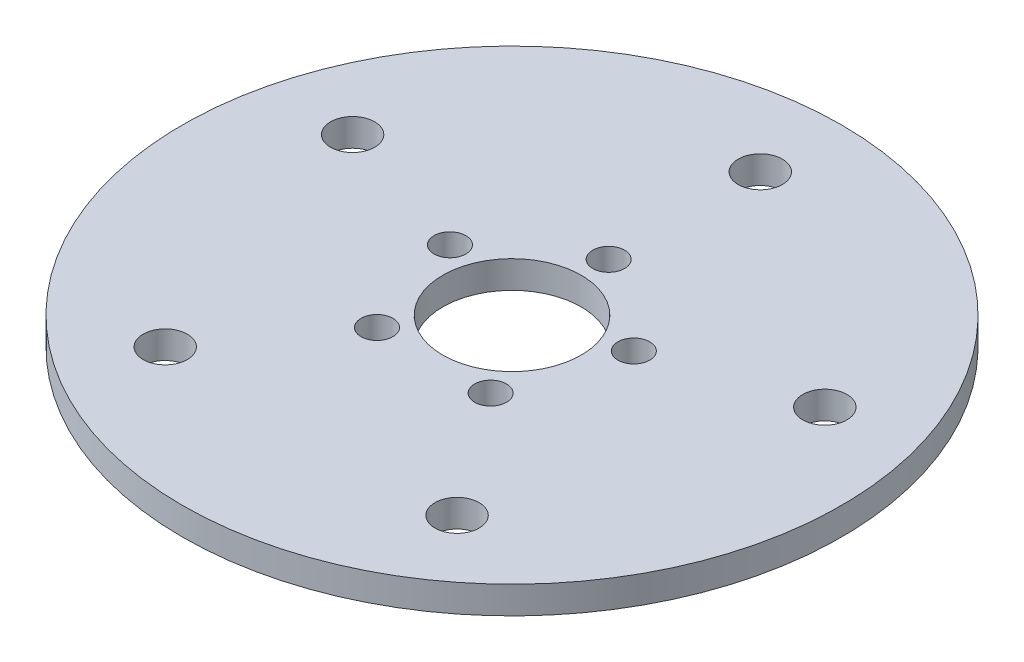
from build123d import *

# Parameters (mm, degrees)
SKETCH1_R           = 38.1
BOSS_EXTRUDE1_DEPTH = 3.175
SKETCH2_R           = 8.001
SKETCH2_R_2         = 1.8415
SKETCH2_R_3         = 2.5527
CUT_EXTRUDE1_DEPTH  = 54.975


with BuildPart() as part:
    # Sketch1 → Boss-Extrude1 (new body)
    with BuildSketch(Plane(origin=(0, 807.11642412, 0), x_dir=(-1, 0, 0), z_dir=(0, 1, 0))):
        Circle(SKETCH1_R)
    extrude(amount=-BOSS_EXTRUDE1_DEPTH)

    # Sketch2 → Cut-Extrude1 (cut, through all)
    with BuildSketch(Plane(origin=(0, 807.11642412, 0), x_dir=(1, 0, 0), z_dir=(0, 1, 0))):
        Circle(SKETCH2_R)
        with Locations((0, 11.176)):
            Circle(SKETCH2_R_2)
        with Locations((10.629007626, 3.453573929)):
            Circle(SKETCH2_R_2)
        with Locations((6.56908798, -9.041573929)):
            Circle(SKETCH2_R_2)
        with Locations((-6.56908798, -9.041573929)):
            Circle(SKETCH2_R_2)
        with Locations((-10.629007626, 3.453573929)):
            Circle(SKETCH2_R_2)
        with Locations((0, 28.702)):
            Circle(SKETCH2_R_3)
        with Locations((27.297224131, 8.869405773)):
            Circle(SKETCH2_R_3)
        with Locations((16.870612311, -23.220405773)):
            Circle(SKETCH2_R_3)
        with Locations((-16.870612311, -23.220405773)):
            Circle(SKETCH2_R_3)
        with Locations((-27.297224131, 8.869405773)):
            Circle(SKETCH2_R_3)
    extrude(amount=-CUT_EXTRUDE1_DEPTH, mode=Mode.SUBTRACT)


solid = part.part
